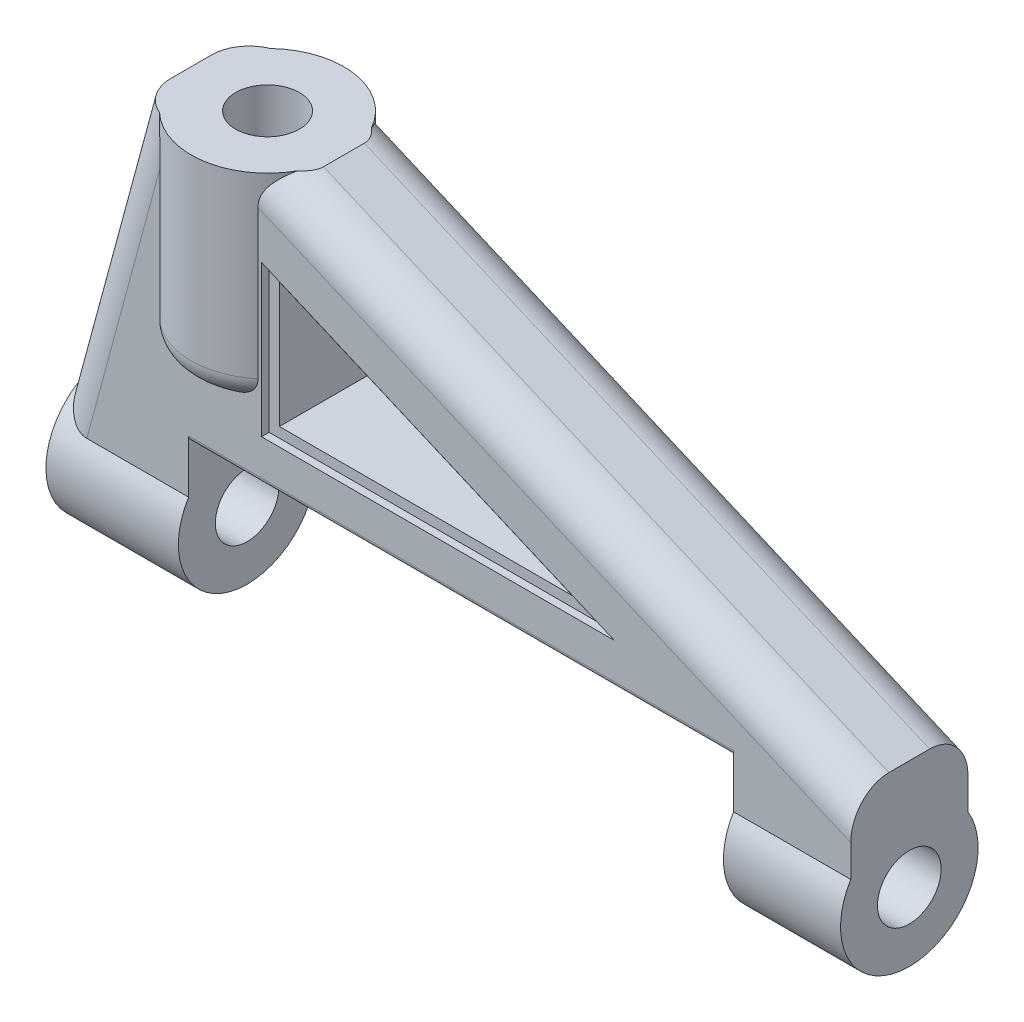
from build123d import *

# Parameters (mm, degrees)
EXTRUDE_1_DEPTH        = 4.6
SKETCH_2_R             = 3
EXTRUDE_2_DEPTH        = 8
SKETCH_3_R             = 2.7
EXTRUDE_3_DEPTH        = 5.2
SKETCH_5_R             = 2.7
EXTRUDE_4_DEPTH        = 4.6
CUT_EXTRUDE_1_DEPTH    = 35.524918537
FILLET_1_R             = 1.5
CUT_EXTRUDE_2_DEPTH    = 30.215920451
CUT_EXTRUDE_3_DEPTH    = 0.3
CUT_EXTRUDE_4_DEPTH    = 0.3
FILLET_2_R             = 0.2
FILLET_3_R             = 1
SKETCH_9_R             = 1.25
CUT_EXTRUDE_5_DEPTH    = 35.524918683
HOLE_WIZARD_M3_1_D     = 2.5
HOLE_WIZARD_M3_1_DEPTH = 6.5
HOLE_WIZARD_M3_1_TIP   = 0.751075774


with BuildPart() as part:
    # 草图1 → 凸台-拉伸1 (new body)
    with BuildSketch(Plane.XY):
        Polygon((-0.8, -2.7), (-0.8, 3.3), (20.6, 3.3), (20.6, -2.7), (25.2, -2.7), (25.2, 4.3), (3, 13.8), (-3, 13.8), (-6, 2.7), (-6, -2.7), align=None)
        Polygon((2.46680021, 10.221171171), (2.46680021, 5.3), (13.96680021, 5.3), align=None, mode=Mode.SUBTRACT)
    extrude(amount=EXTRUDE_1_DEPTH)

    # 草图2 → 凸台-拉伸2 (add)
    with BuildSketch(Plane(origin=(0, 13.8, 0), x_dir=(1, 0, 0), z_dir=(0, 1, 0))):
        with Locations((0, -2.3)):
            Circle(SKETCH_2_R)
    extrude(amount=-EXTRUDE_2_DEPTH)

    # 草图3 → 凸台-拉伸3 (add)
    with BuildSketch(Plane.ZY.offset(6)):
        with Locations((2.3, 0)):
            Circle(SKETCH_3_R)
    extrude(amount=-EXTRUDE_3_DEPTH)

    # 草图5 → 凸台-拉伸4 (add)
    with BuildSketch(Plane.ZY.offset(-20.6)):
        with Locations((2.3, 0)):
            Circle(SKETCH_5_R)
    extrude(amount=-EXTRUDE_4_DEPTH)

    # 草图4 → 切除-拉伸1 (cut, through all)
    with BuildSketch(Plane.ZY.offset(6)):
        with BuildLine():
            ThreePointArc((4.6, -1.414213562), (3.617502065, -2.356732549), (2.3, -2.7))
            Line((2.3, -2.7), (4.6, -2.7))
            Line((4.6, -2.7), (4.6, -1.414213562))
        make_face()
        with BuildLine():
            ThreePointArc((2.3, -2.7), (0.982497935, -2.356732549), (0, -1.414213562))
            Line((0, -1.414213562), (0, -2.7))
            Line((0, -2.7), (2.3, -2.7))
        make_face()
    extrude(amount=-CUT_EXTRUDE_1_DEPTH, mode=Mode.SUBTRACT)

    # 圆角1
    # the kernel refuses this fillet: 1.5 mm, written as the material it takes off along each edge
    with BuildSketch(Plane(origin=(-2.021591156, 17.420112724, 0), x_dir=(0.9653633930282662, -0.26090902514277475, 0), z_dir=(-0.2609090251427748, -0.9653633930282663, 0))) as fillet_1_piece_1_section:
        with BuildLine():
            CenterArc((FILLET_1_R, FILLET_1_R), FILLET_1_R, 180, 90)
            Line((0, FILLET_1_R), (0, 0))
            Line((0, 0), (FILLET_1_R, 0))
        make_face()
    fillet_1_piece_1 = extrude(amount=18.998260738, mode=Mode.PRIVATE)
    fillet_1_piece_1 = fillet_1_piece_1 - Plane(origin=(-4.247071053, 0, 2.3), x_dir=(0, 0, 1), z_dir=(-1, 0, 0)) * Cylinder(2.7, 44, mode=Mode.PRIVATE)
    fillet_1_piece_1 = fillet_1_piece_1 - Plane(origin=(0, 7.876054914, 2.3), x_dir=(1, 0, 0), z_dir=(0, 1, 0)) * Cylinder(3, 44, mode=Mode.PRIVATE)
    add(fillet_1_piece_1, mode=Mode.SUBTRACT)
    with BuildSketch(Plane(origin=(-2.021591156, 17.420112724, 4.6), x_dir=(0.9653633930282662, -0.26090902514277475, 0), z_dir=(-0.2609090251427748, -0.9653633930282663, 0))) as fillet_1_piece_2_section:
        with BuildLine():
            CenterArc((FILLET_1_R, -FILLET_1_R), FILLET_1_R, 90, 90)
            Line((0, -FILLET_1_R), (0, 0))
            Line((0, 0), (FILLET_1_R, 0))
        make_face()
    fillet_1_piece_2 = extrude(amount=18.998260738, mode=Mode.PRIVATE)
    fillet_1_piece_2 = fillet_1_piece_2 - Plane(origin=(-4.247069139, 0, 2.3), x_dir=(0, 0, 1), z_dir=(-1, 0, 0)) * Cylinder(2.7, 44, mode=Mode.PRIVATE)
    fillet_1_piece_2 = fillet_1_piece_2 - Plane(origin=(0, 7.876066276, 2.3), x_dir=(1, 0, 0), z_dir=(0, 1, 0)) * Cylinder(3, 44, mode=Mode.PRIVATE)
    add(fillet_1_piece_2, mode=Mode.SUBTRACT)
    with BuildSketch(Plane(origin=(28.647596614, 2.824677125, 0), x_dir=(-0.39341943343746105, -0.9193590970854355, 0), z_dir=(-0.9193590970854355, 0.39341943343746105, 0))) as fillet_1_piece_3_section:
        with BuildLine():
            CenterArc((FILLET_1_R, FILLET_1_R), FILLET_1_R, 180, 90)
            Line((0, FILLET_1_R), (0, 0))
            Line((0, 0), (FILLET_1_R, 0))
        make_face()
    fillet_1_piece_3 = extrude(amount=31.647256573, mode=Mode.PRIVATE)
    fillet_1_piece_3 = fillet_1_piece_3 - Plane(origin=(0, 8.805883363, 2.3), x_dir=(1, 0, 0), z_dir=(0, 1, 0)) * Cylinder(3, 70, mode=Mode.PRIVATE)
    add(fillet_1_piece_3, mode=Mode.SUBTRACT)
    with BuildSketch(Plane(origin=(28.647596614, 2.824677125, 4.6), x_dir=(-0.39341943343746105, -0.9193590970854355, 0), z_dir=(-0.9193590970854355, 0.39341943343746105, 0))) as fillet_1_piece_4_section:
        with BuildLine():
            CenterArc((FILLET_1_R, -FILLET_1_R), FILLET_1_R, 90, 90)
            Line((0, -FILLET_1_R), (0, 0))
            Line((0, 0), (FILLET_1_R, 0))
        make_face()
    fillet_1_piece_4 = extrude(amount=31.647256573, mode=Mode.PRIVATE)
    fillet_1_piece_4 = fillet_1_piece_4 - Plane(origin=(0, 8.805887847, 2.3), x_dir=(1, 0, 0), z_dir=(0, 1, 0)) * Cylinder(3, 70, mode=Mode.PRIVATE)
    add(fillet_1_piece_4, mode=Mode.SUBTRACT)

    # 草图6 → 切除-拉伸2 (cut, through all)
    with BuildSketch(Plane.XY.offset(4.6)):
        Polygon((13.96680021, 5.3), (2.46680021, 10.221171171), (2.46680021, 5.3), align=None)
    extrude(amount=-CUT_EXTRUDE_2_DEPTH, mode=Mode.SUBTRACT)

    # 草图7 → 切除-拉伸3 (cut)
    with BuildSketch(Plane.XY.offset(4.6)):
        Polygon((2.06680021, 10.827428046), (2.06680021, 4.9), (15.918263645, 4.9), align=None)
        Polygon((2.46680021, 10.221171171), (2.46680021, 5.3), (13.96680021, 5.3), align=None, mode=Mode.SUBTRACT)
    extrude(amount=-CUT_EXTRUDE_3_DEPTH, mode=Mode.SUBTRACT)

    # 草图8 → 切除-拉伸4 (cut)
    with BuildSketch(Plane(origin=(0, 0, 0), x_dir=(-1, 0, 0), z_dir=(0, 0, -1))):
        Polygon((-2.06680021, 4.9), (-2.06680021, 10.827428046), (-15.918263645, 4.9), align=None)
        Polygon((-2.46680021, 5.3), (-2.46680021, 10.221171171), (-13.96680021, 5.3), align=None, mode=Mode.SUBTRACT)
    extrude(amount=-CUT_EXTRUDE_4_DEPTH, mode=Mode.SUBTRACT)

    # 圆角2
    fillet_2_edges = [part.edges().sort_by_distance(p)[0] for p in [
        (9.9, 3.3, 4.6),
        (9.9, 3.3, 0),
    ]]
    fillet(fillet_2_edges, radius=FILLET_2_R)

    # 圆角3
    # the kernel refuses this fillet: 1 mm, written as the material it takes off along each edge
    with BuildSketch(Plane(origin=(0, 5.8, 2.3), x_dir=(-0.9991986620043835, 0, 0.040025415034074786), z_dir=(-0.040025415034074786, 0, -0.9991986620043835))) as fillet_3_piece_1_section:
        with BuildLine():
            CenterArc((3 - FILLET_3_R, FILLET_3_R), FILLET_3_R, 270, 90)
            Line((3 - FILLET_3_R, 0), (3, 0))
            Line((3, 0), (3, FILLET_3_R))
        make_face()
    fillet_3_piece_1 = revolve(axis=Axis((0, 5.8, 2.3), (0, 1, 0)), revolution_arc=175.412199766, mode=Mode.PRIVATE)
    fillet_3_piece_1 = split(fillet_3_piece_1, bisect_by=Plane(origin=(0, 6.202737669, 4.6), z_dir=(0, 0, 1)), keep=Keep.TOP, mode=Mode.PRIVATE)
    add(fillet_3_piece_1, mode=Mode.SUBTRACT)
    with BuildSketch(Plane(origin=(0, 5.8, 2.3), x_dir=(0.9991986620043835, 0, -0.04002541503407598), z_dir=(0.04002541503407598, 0, 0.9991986620043835))) as fillet_3_piece_2_section:
        with BuildLine():
            CenterArc((3 - FILLET_3_R, FILLET_3_R), FILLET_3_R, 270, 90)
            Line((3 - FILLET_3_R, 0), (3, 0))
            Line((3, 0), (3, FILLET_3_R))
        make_face()
    fillet_3_piece_2 = revolve(axis=Axis((0, 5.8, 2.3), (0, 1, 0)), revolution_arc=175.412199766, mode=Mode.PRIVATE)
    fillet_3_piece_2 = split(fillet_3_piece_2, bisect_by=Plane(origin=(0, 6.202737669, 0), z_dir=(0, 0, -1)), keep=Keep.TOP, mode=Mode.PRIVATE)
    add(fillet_3_piece_2, mode=Mode.SUBTRACT)

    # 草图9 → 切除-拉伸5 (cut, through all)
    with BuildSketch(Plane.ZY.offset(6)):
        with Locations((2.3, 0)):
            Circle(SKETCH_9_R)
    extrude(amount=-CUT_EXTRUDE_5_DEPTH, mode=Mode.SUBTRACT)

    # M3 螺纹孔1
    with Locations(Plane(origin=(0, 13.8, 2.3), x_dir=(0, 0, 1), z_dir=(0, 1, 0))):
        with Locations((0, 0)):
            Hole(HOLE_WIZARD_M3_1_D / 2, depth=HOLE_WIZARD_M3_1_DEPTH)
            with Locations((0, 0, -(HOLE_WIZARD_M3_1_DEPTH + HOLE_WIZARD_M3_1_TIP / 2))):  # 118° drill point
                Cone(0, HOLE_WIZARD_M3_1_D / 2, HOLE_WIZARD_M3_1_TIP, mode=Mode.SUBTRACT)


solid = part.part
